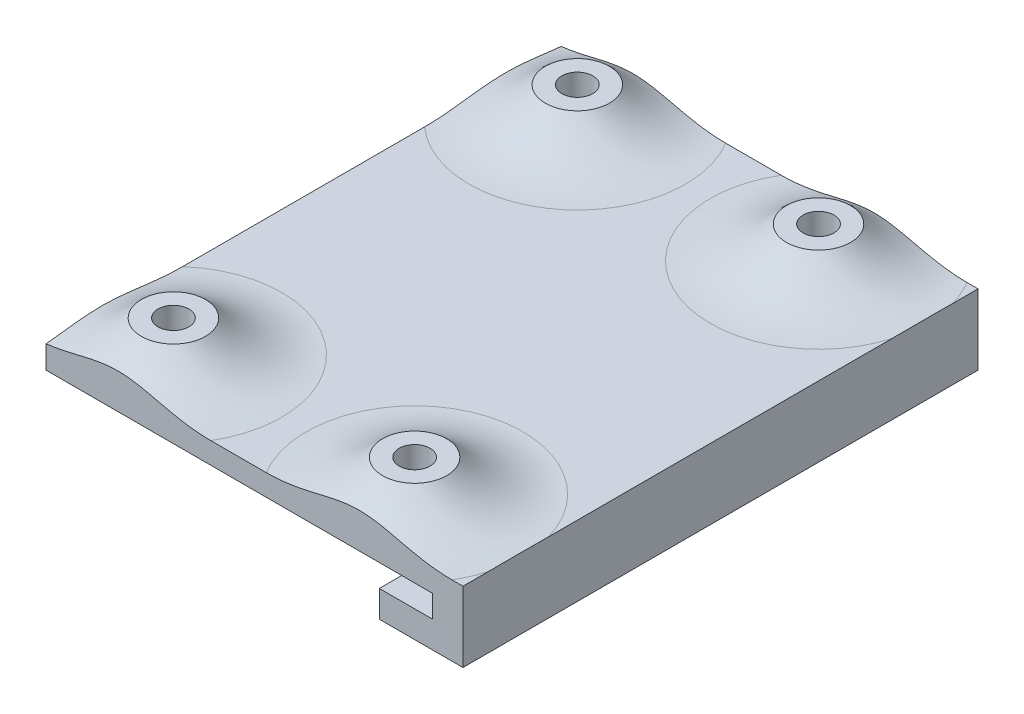
from build123d import *

# Parameters (mm, degrees)
ESQUISSE1_W             = 36.068
ESQUISSE1_H             = 48.26
BOSS_EXTRU_1_DEPTH      = 2
ESQUISSE4_R             = 3
BOSS_EXTRU_2_DEPTH      = 3
ESQUISSE6_R             = 1.45
ENL_V_MAT_EXTRU_1_DEPTH = 31.536569159
ESQUISSE10_W            = 48.26
ESQUISSE10_H            = 2
BOSS_EXTRU_3_DEPTH      = 3
ESQUISSE11_W            = 2.839594579
ESQUISSE11_H            = 48.26
BOSS_EXTRU_4_DEPTH      = 4.6
ESQUISSE12_W            = 48.26
ESQUISSE12_H            = 2.5
BOSS_EXTRU_5_DEPTH      = 5
CONG_1_R                = 10
CONG_2_R                = 10


with BuildPart() as part:
    # Esquisse1 → Boss.-Extru.1 (new body)
    with BuildSketch(Plane(origin=(0, 0, 0), x_dir=(1, 0, 0), z_dir=(0, 1, 0))):
        Rectangle(ESQUISSE1_W, ESQUISSE1_H)
    extrude(amount=BOSS_EXTRU_1_DEPTH)

    # Esquisse4 → Boss.-Extru.2 (add)
    with BuildSketch(Plane(origin=(0, 2, 0), x_dir=(1, 0, 0), z_dir=(0, 1, 0))):
        with Locations(Location((11.3, 18.921, 0), (0, 0, 270))):
            Circle(ESQUISSE4_R)
        with Locations(Location((11.3, -18.925, 0), (0, 0, 270))):
            Circle(ESQUISSE4_R)
    boss_extru_2 = extrude(amount=BOSS_EXTRU_2_DEPTH)

    # Esquisse6 → Enlèv. mat.-Extru.1 (cut, through all)
    with BuildSketch(Plane(origin=(0, 5, 0), x_dir=(1, 0, 0), z_dir=(0, 1, 0))):
        with Locations(Location((11.3, 18.921, 0), (0, 0, 270))):
            Circle(ESQUISSE6_R)
        with Locations(Location((11.3, -18.925, 0), (0, 0, 270))):
            Circle(ESQUISSE6_R)
    enl_v_mat_extru_1 = extrude(amount=-ENL_V_MAT_EXTRU_1_DEPTH, mode=Mode.SUBTRACT)

    # Symétrie1: Boss.-Extru.2, Enlèv. mat.-Extru.1 across plane
    add(boss_extru_2.mirror(Plane(origin=(0, 0, 0), x_dir=(0, 0, 1), z_dir=(1, 0, 0))))
    add(enl_v_mat_extru_1.mirror(Plane(origin=(0, 0, 0), x_dir=(0, 0, 1), z_dir=(1, 0, 0))), mode=Mode.SUBTRACT)

    # Esquisse10 → Boss.-Extru.3 (add)
    with BuildSketch(Plane(origin=(18.034, 0, 0), x_dir=(0, 0, -1), z_dir=(1, 0, 0))):
        with Locations((0, 1)):
            Rectangle(ESQUISSE10_W, ESQUISSE10_H)
    extrude(amount=BOSS_EXTRU_3_DEPTH)

    # Esquisse11 → Boss.-Extru.4 (add)
    with BuildSketch(Plane(origin=(0, 0, 0), x_dir=(-1, 0, 0), z_dir=(0, -1, 0))):
        with Locations((-19.614202711, 0)):
            Rectangle(ESQUISSE11_W, ESQUISSE11_H)
    extrude(amount=BOSS_EXTRU_4_DEPTH)

    # Esquisse12 → Boss.-Extru.5 (add)
    with BuildSketch(Plane.ZY.offset(-18.194405421)):
        with Locations((0, -3.35)):
            Rectangle(ESQUISSE12_W, ESQUISSE12_H)
    extrude(amount=BOSS_EXTRU_5_DEPTH)

    # Congé1
    # the kernel refuses this fillet: 10 mm, written as the material it adds along each edge
    with BuildSketch(Plane(origin=(-11.3, 2, -18.921), x_dir=(0, 0, 1), z_dir=(1, 0, 0))) as cong_1_piece_1_section:
        with BuildLine():
            CenterArc((10.141428429, -10), CONG_1_R, 90, 45.572995999)
            Line((10.141428429, 0), (10.141428429, 0.2))
            Line((10.141428429, 0.2), (3, 0.2))
            Line((3, 0.2), (2.8, 0))
            ThreePointArc((2.8, 0), (2.8, -1.5), (2.857171431, -2.86))
            Line((2.857171431, -2.86), (3, -3))
        make_face()
    cong_1_piece_1 = revolve(axis=Axis((-11.3, 2, -18.921), (0, -1, 0)), mode=Mode.PRIVATE)
    cong_1_piece_1 = split(cong_1_piece_1, bisect_by=Plane(origin=(-14.721075744, 4.069321611, -24.13), z_dir=(0, 0, 1)), keep=Keep.TOP, mode=Mode.PRIVATE)
    cong_1_piece_1 = split(cong_1_piece_1, bisect_by=Plane(origin=(-18.034, 4.069321611, -16.945840998), z_dir=(1, 0, 0)), keep=Keep.TOP, mode=Mode.PRIVATE)
    add(cong_1_piece_1)
    with BuildSketch(Plane(origin=(-11.3, 2, 18.925), x_dir=(0, 0, 1), z_dir=(1, 0, 0))) as cong_1_piece_2_section:
        with BuildLine():
            CenterArc((10.141428429, -10), CONG_1_R, 90, 45.572995999)
            Line((10.141428429, 0), (10.141428429, 0.2))
            Line((10.141428429, 0.2), (3, 0.2))
            Line((3, 0.2), (2.8, 0))
            ThreePointArc((2.8, 0), (2.8, -1.5), (2.857171431, -2.86))
            Line((2.857171431, -2.86), (3, -3))
        make_face()
    cong_1_piece_2 = revolve(axis=Axis((-11.3, 2, 18.925), (0, -1, 0)), mode=Mode.PRIVATE)
    cong_1_piece_2 = split(cong_1_piece_2, bisect_by=Plane(origin=(-11.3, 2.724138959, 24.13), z_dir=(0, 0, -1)), keep=Keep.TOP, mode=Mode.PRIVATE)
    cong_1_piece_2 = split(cong_1_piece_2, bisect_by=Plane(origin=(-18.034, 2.724138959, 12.680212615), z_dir=(1, 0, 0)), keep=Keep.TOP, mode=Mode.PRIVATE)
    add(cong_1_piece_2)

    # Congé2
    # the kernel refuses this fillet: 10 mm, written as the material it adds along each edge
    with BuildSketch(Plane(origin=(11.3, 2, -18.921), x_dir=(0, 0, 1), z_dir=(-1, 0, 0))) as cong_2_piece_1_section:
        with BuildLine():
            CenterArc((10.141428429, 10), CONG_2_R, 224.427004001, 45.572995999)
            Line((10.141428429, 0), (10.141428429, -0.2))
            Line((10.141428429, -0.2), (3, -0.2))
            Line((3, -0.2), (2.8, 0))
            ThreePointArc((2.8, 0), (2.8, 1.5), (2.857171431, 2.86))
            Line((2.857171431, 2.86), (3, 3))
        make_face()
    cong_2_piece_1 = revolve(axis=Axis((11.3, 2, -18.921), (0, 1, 0)), mode=Mode.PRIVATE)
    cong_2_piece_1 = split(cong_2_piece_1, bisect_by=Plane(origin=(14.72056947, 4.068572758, -24.13), z_dir=(0, 0, 1)), keep=Keep.TOP, mode=Mode.PRIVATE)
    cong_2_piece_1 = split(cong_2_piece_1, bisect_by=Plane(origin=(21.034, 4.068572758, -16.946133295), z_dir=(-1, 0, 0)), keep=Keep.TOP, mode=Mode.PRIVATE)
    add(cong_2_piece_1)
    with BuildSketch(Plane(origin=(11.3, 2, 18.925), x_dir=(0, 0, 1), z_dir=(-1, 0, 0))) as cong_2_piece_2_section:
        with BuildLine():
            CenterArc((10.141428429, 10), CONG_2_R, 224.427004001, 45.572995999)
            Line((10.141428429, 0), (10.141428429, -0.2))
            Line((10.141428429, -0.2), (3, -0.2))
            Line((3, -0.2), (2.8, 0))
            ThreePointArc((2.8, 0), (2.8, 1.5), (2.857171431, 2.86))
            Line((2.857171431, 2.86), (3, 3))
        make_face()
    cong_2_piece_2 = revolve(axis=Axis((11.3, 2, 18.925), (0, 1, 0)), mode=Mode.PRIVATE)
    cong_2_piece_2 = split(cong_2_piece_2, bisect_by=Plane(origin=(21.034, 2.723263104, 12.680580548), z_dir=(-1, 0, 0)), keep=Keep.TOP, mode=Mode.PRIVATE)
    cong_2_piece_2 = split(cong_2_piece_2, bisect_by=Plane(origin=(11.3, 2.723263104, 24.13), z_dir=(0, 0, -1)), keep=Keep.TOP, mode=Mode.PRIVATE)
    add(cong_2_piece_2)


solid = part.part
